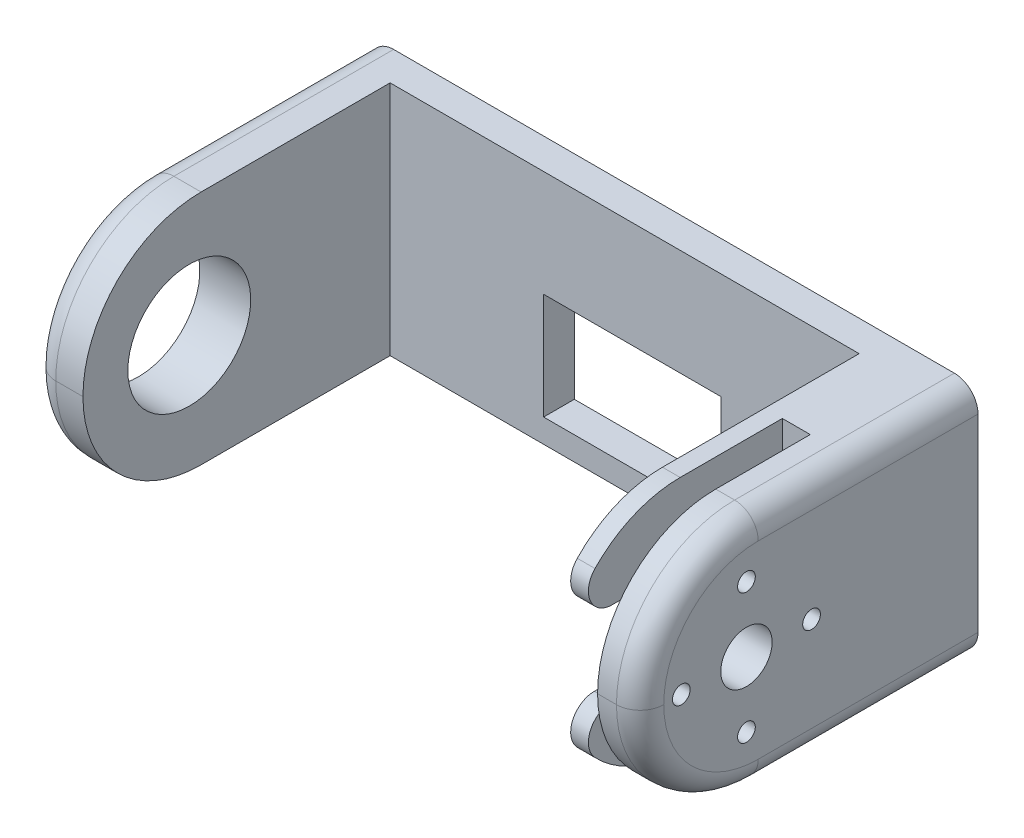
from build123d import *

# Parameters (mm, degrees)
SKETCH1_W           = 65.359412811
SKETCH1_H           = 25.4
BOSS_EXTRUDE1_DEPTH = 36.322
SKETCH4_W           = 50.419
SKETCH4_H           = 33.02
SKETCH4_W_2         = 2.9972
SKETCH4_H_2         = 22.86
CUT_EXTRUDE1_DEPTH  = 78.438347632
CUT_EXTRUDE2_REACH  = 80.97
SKETCH5_R           = 2.76225
CUT_EXTRUDE3_REACH  = 80.97
SKETCH6_R           = 0.9525
CUT_EXTRUDE5_REACH  = 80.97
SKETCH7_R           = 6.604
SKETCH7_R_2         = 0.9525
CUT_EXTRUDE6_REACH  = 73.327
FILLET1_R           = 12.7
FILLET2_R           = 2.54
SKETCH10_W          = 19.05
SKETCH10_H          = 11.43
CUT_EXTRUDE7_DEPTH  = 78.438347679


with BuildPart() as part:
    # Sketch1 → Boss-Extrude1 (new body)
    with BuildSketch(Plane.XY):
        with Locations((-30.820293595, 12.7)):
            Rectangle(SKETCH1_W, SKETCH1_H)
    extrude(amount=BOSS_EXTRUDE1_DEPTH)

    # Sketch4 → Cut-Extrude1 (cut, through all)
    with BuildSketch(Plane(origin=(0, 25.4, 0), x_dir=(1, 0, 0), z_dir=(0, 1, 0))):
        with Locations((-32.824287189, -19.812)):
            Rectangle(SKETCH4_W, SKETCH4_H)
        with Locations((-4.211187189, -24.892)):
            Rectangle(SKETCH4_W_2, SKETCH4_H_2)
    extrude(amount=-CUT_EXTRUDE1_DEPTH, mode=Mode.SUBTRACT)

    # Sketch5 → Cut-Extrude2 (cut, up to next)
    with BuildSketch(Plane(origin=(1.859412811, 0, 0), x_dir=(0, 0, -1), z_dir=(1, 0, 0)), mode=Mode.PRIVATE) as cut_extrude2_sk1:
        with Locations(Location((-24.892, 12.7, 0), (0, 0, 90))):
            Circle(SKETCH5_R)
    cut_extrude2_tool1 = extrude(cut_extrude2_sk1.sketch, amount=-CUT_EXTRUDE2_REACH, mode=Mode.PRIVATE) & part.part
    add(cut_extrude2_tool1.solids().sort_by_distance((1.859413, 12.7, 24.892))[0], mode=Mode.SUBTRACT)

    # Cut-Extrude3: up to this face of the body (flat: up to its plane)
    cut_extrude3_end = Plane(part.part.faces().sort_by_distance((-7.614787189, 12.7, 19.812))[0])
    # Sketch6 → Cut-Extrude3 (cut, up to the picked face)
    with BuildSketch(Plane(origin=(1.859412811, 0, 0), x_dir=(0, 0, -1), z_dir=(1, 0, 0)), mode=Mode.PRIVATE) as cut_extrude3_sk1:
        with Locations(Location((-24.892, 12.7, 0), (0, 0, 90))):
            Circle(SKETCH6_R)
    cut_extrude3_tool1 = split(extrude(cut_extrude3_sk1.sketch, amount=-CUT_EXTRUDE3_REACH, mode=Mode.PRIVATE), bisect_by=cut_extrude3_end, keep=Keep.BOTH, mode=Mode.PRIVATE)
    # Sketch6 → Cut-Extrude3 (cut, up to the picked face)
    with BuildSketch(Plane(origin=(1.859412811, 0, 0), x_dir=(0, 0, -1), z_dir=(1, 0, 0)), mode=Mode.PRIVATE) as cut_extrude3_sk2:
        with Locations(Location((-24.892, 19.7, 0), (0, 0, 90))):
            Circle(SKETCH6_R)
    cut_extrude3_tool2 = split(extrude(cut_extrude3_sk2.sketch, amount=-CUT_EXTRUDE3_REACH, mode=Mode.PRIVATE), bisect_by=cut_extrude3_end, keep=Keep.BOTH, mode=Mode.PRIVATE)
    # Sketch6 → Cut-Extrude3 (cut, up to the picked face)
    with BuildSketch(Plane(origin=(1.859412811, 0, 0), x_dir=(0, 0, -1), z_dir=(1, 0, 0)), mode=Mode.PRIVATE) as cut_extrude3_sk3:
        with Locations(Location((-17.892, 12.7, 0), (0, 0, 90))):
            Circle(SKETCH6_R)
    cut_extrude3_tool3 = split(extrude(cut_extrude3_sk3.sketch, amount=-CUT_EXTRUDE3_REACH, mode=Mode.PRIVATE), bisect_by=cut_extrude3_end, keep=Keep.BOTH, mode=Mode.PRIVATE)
    # Sketch6 → Cut-Extrude3 (cut, up to the picked face)
    with BuildSketch(Plane(origin=(1.859412811, 0, 0), x_dir=(0, 0, -1), z_dir=(1, 0, 0)), mode=Mode.PRIVATE) as cut_extrude3_sk4:
        with Locations(Location((-24.892, 5.7, 0), (0, 0, 90))):
            Circle(SKETCH6_R)
    cut_extrude3_tool4 = split(extrude(cut_extrude3_sk4.sketch, amount=-CUT_EXTRUDE3_REACH, mode=Mode.PRIVATE), bisect_by=cut_extrude3_end, keep=Keep.BOTH, mode=Mode.PRIVATE)
    # Sketch6 → Cut-Extrude3 (cut, up to the picked face)
    with BuildSketch(Plane(origin=(1.859412811, 0, 0), x_dir=(0, 0, -1), z_dir=(1, 0, 0)), mode=Mode.PRIVATE) as cut_extrude3_sk5:
        with Locations(Location((-31.892, 12.7, 0), (0, 0, 90))):
            Circle(SKETCH6_R)
    cut_extrude3_tool5 = split(extrude(cut_extrude3_sk5.sketch, amount=-CUT_EXTRUDE3_REACH, mode=Mode.PRIVATE), bisect_by=cut_extrude3_end, keep=Keep.BOTH, mode=Mode.PRIVATE)
    add(cut_extrude3_tool1.solids().sort_by(Axis((1.859413, 12.7, 24.892), (-1, 0, 0)))[0], mode=Mode.SUBTRACT)
    add(cut_extrude3_tool2.solids().sort_by(Axis((1.859413, 19.7, 24.892), (-1, 0, 0)))[0], mode=Mode.SUBTRACT)
    add(cut_extrude3_tool3.solids().sort_by(Axis((1.859413, 12.7, 17.892), (-1, 0, 0)))[0], mode=Mode.SUBTRACT)
    add(cut_extrude3_tool4.solids().sort_by(Axis((1.859413, 5.7, 24.892), (-1, 0, 0)))[0], mode=Mode.SUBTRACT)
    add(cut_extrude3_tool5.solids().sort_by(Axis((1.859413, 12.7, 31.892), (-1, 0, 0)))[0], mode=Mode.SUBTRACT)

    # Sketch7 → Cut-Extrude5 (cut, up to next)
    with BuildSketch(Plane.ZY.offset(63.5), mode=Mode.PRIVATE) as cut_extrude5_sk1:
        with Locations((24.892, 12.7)):
            Circle(SKETCH7_R)
        with Locations(Location((24.892, 12.7, 0), (0, 0, 90))):
            Circle(SKETCH7_R_2, mode=Mode.SUBTRACT)
    cut_extrude5_tool1 = extrude(cut_extrude5_sk1.sketch, amount=-CUT_EXTRUDE5_REACH, mode=Mode.PRIVATE) & part.part
    # Sketch7 → Cut-Extrude5 (cut, up to next)
    with BuildSketch(Plane.ZY.offset(63.5), mode=Mode.PRIVATE) as cut_extrude5_sk2:
        with Locations(Location((24.892, 12.7, 0), (0, 0, 90))):
            Circle(SKETCH7_R_2)
    cut_extrude5_tool2 = extrude(cut_extrude5_sk2.sketch, amount=-CUT_EXTRUDE5_REACH, mode=Mode.PRIVATE) & part.part
    add(cut_extrude5_tool1.solids().sort_by_distance((-63.5, 12.7, 18.474789))[0], mode=Mode.SUBTRACT)
    add(cut_extrude5_tool2.solids().sort_by_distance((-63.5, 12.7, 24.892))[0], mode=Mode.SUBTRACT)

    # Sketch8 → Cut-Extrude6 (cut, up to next)
    with BuildSketch(Plane.ZY.offset(7.614787189), mode=Mode.PRIVATE) as cut_extrude6_sk1:
        with BuildLine():
            Line((36.322, 17.2), (23.622, 17.2))
            ThreePointArc((23.622, 17.2), (19.122, 12.7), (23.622, 8.2))
            Line((23.622, 8.2), (36.322, 8.2))
            Line((36.322, 8.2), (36.322, 17.2))
        make_face()
    cut_extrude6_tool1 = extrude(cut_extrude6_sk1.sketch, amount=-CUT_EXTRUDE6_REACH, mode=Mode.PRIVATE) & part.part
    add(cut_extrude6_tool1.solids().sort_by_distance((-7.614787, 12.7, 28.173785))[0], mode=Mode.SUBTRACT)

    # Fillet1
    # the kernel refuses this fillet: 12.7 mm, written as the material it takes off along each edge
    with BuildSketch(Plane(origin=(-63.5, 0, 36.322), x_dir=(0, 0, -1), z_dir=(1, 0, 0))) as fillet1_piece_1:
        with BuildLine():
            CenterArc((FILLET1_R, FILLET1_R), FILLET1_R, 180, 90)
            Line((0, FILLET1_R), (-FILLET1_R * 0.02, FILLET1_R))
            Line((-FILLET1_R * 0.02, FILLET1_R), (-FILLET1_R * 0.02, -FILLET1_R * 0.02))
            Line((-FILLET1_R * 0.02, -FILLET1_R * 0.02), (FILLET1_R, -FILLET1_R * 0.02))
            Line((FILLET1_R, -FILLET1_R * 0.02), (FILLET1_R, 0))
        make_face()
    extrude(amount=5.466212811, mode=Mode.SUBTRACT)
    with BuildSketch(Plane(origin=(-7.614787189, 0, 36.322), x_dir=(0, 0, -1), z_dir=(1, 0, 0)), Plane(origin=(-5.709787189, 25.4, 36.322), x_dir=(0, 0, -1), z_dir=(-1, 0, 0))) as fillet1_piece_2:
        with BuildLine():
            CenterArc((11.876026271, 12.7), FILLET1_R, 200.752430643, 69.247569357)
            Line((0, 8.2), (-0.237520525, 8.11))
            ThreePointArc((-0.237520525, 8.11), (-0.254, 4.1), (-0.254, 0))
            Line((-0.254, 0), (0, -0.254))
            Line((0, -0.254), (11.876026271, -0.254))
            Line((11.876026271, -0.254), (11.876026271, 0))
        make_face()
    extrude(amount=1.905, mode=Mode.SUBTRACT)
    with BuildSketch(Plane(origin=(-2.712587189, 0, 36.322), x_dir=(0, 0, -1), z_dir=(1, 0, 0))) as fillet1_piece_3:
        with BuildLine():
            CenterArc((FILLET1_R, FILLET1_R), FILLET1_R, 180, 90)
            Line((0, FILLET1_R), (-FILLET1_R * 0.02, FILLET1_R))
            Line((-FILLET1_R * 0.02, FILLET1_R), (-FILLET1_R * 0.02, -FILLET1_R * 0.02))
            Line((-FILLET1_R * 0.02, -FILLET1_R * 0.02), (FILLET1_R, -FILLET1_R * 0.02))
            Line((FILLET1_R, -FILLET1_R * 0.02), (FILLET1_R, 0))
        make_face()
    extrude(amount=4.572, mode=Mode.SUBTRACT)
    with BuildSketch(Plane(origin=(1.859412811, 25.4, 36.322), x_dir=(0, -1, 0), z_dir=(-1, 0, 0))) as fillet1_piece_4:
        with BuildLine():
            CenterArc((FILLET1_R, -FILLET1_R), FILLET1_R, 90, 90)
            Line((0, -FILLET1_R), (-FILLET1_R * 0.02, -FILLET1_R))
            Line((-FILLET1_R * 0.02, -FILLET1_R), (-FILLET1_R * 0.02, FILLET1_R * 0.02))
            Line((-FILLET1_R * 0.02, FILLET1_R * 0.02), (FILLET1_R, FILLET1_R * 0.02))
            Line((FILLET1_R, FILLET1_R * 0.02), (FILLET1_R, 0))
        make_face()
    extrude(amount=4.572, mode=Mode.SUBTRACT)
    with BuildSketch(Plane(origin=(-58.033787189, 25.4, 36.322), x_dir=(0, -1, 0), z_dir=(-1, 0, 0))) as fillet1_piece_5:
        with BuildLine():
            CenterArc((FILLET1_R, -FILLET1_R), FILLET1_R, 90, 90)
            Line((0, -FILLET1_R), (-FILLET1_R * 0.02, -FILLET1_R))
            Line((-FILLET1_R * 0.02, -FILLET1_R), (-FILLET1_R * 0.02, FILLET1_R * 0.02))
            Line((-FILLET1_R * 0.02, FILLET1_R * 0.02), (FILLET1_R, FILLET1_R * 0.02))
            Line((FILLET1_R, FILLET1_R * 0.02), (FILLET1_R, 0))
        make_face()
    extrude(amount=5.466212811, mode=Mode.SUBTRACT)

    # Fillet2
    fillet2_edges = [part.edges().sort_by_distance(p)[0] for p in [
        (-6.662287189, 8.2, 36.322),
        (-6.662287189, 17.2, 36.322),
        (-63.5, 0, 11.811),
        (1.859412811, 0, 11.811),
        (-63.5, 25.4, 11.811),
        (-63.5, 21.680256121, 32.602256121),
        (-63.5, 3.719743879, 32.602256121),
        (1.859412811, 25.4, 11.811),
        (1.859412811, 21.680256121, 32.602256121),
        (1.859412811, 3.719743879, 32.602256121),
    ]]
    fillet(fillet2_edges, radius=FILLET2_R)

    # Sketch10 → Cut-Extrude7 (cut, through all)
    with BuildSketch(Plane(origin=(0, 0, 0), x_dir=(-1, 0, 0), z_dir=(0, 0, -1))):
        with Locations((32.007264904, 8.255)):
            Rectangle(SKETCH10_W, SKETCH10_H)
    extrude(amount=-CUT_EXTRUDE7_DEPTH, mode=Mode.SUBTRACT)


solid = part.part
